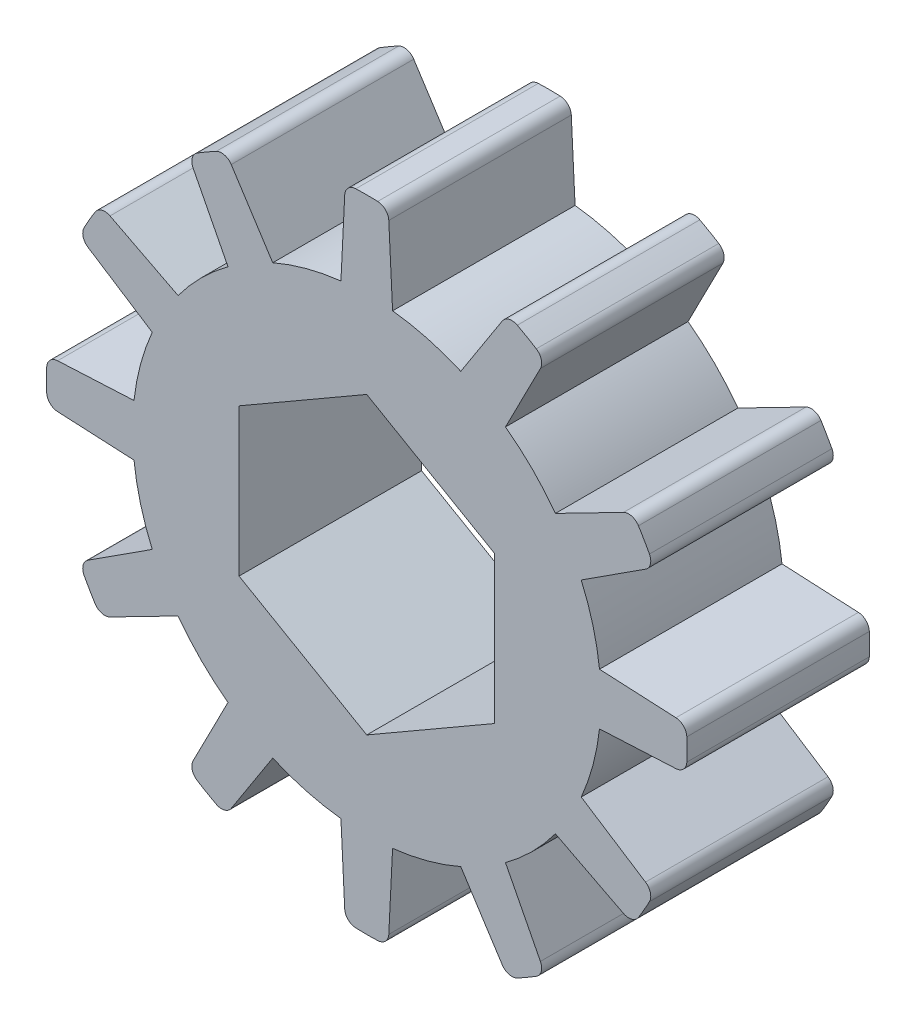
from build123d import *

# Parameters (mm, degrees)
CROQUIS1_R              = 0.5
SALIENTE_EXTRUIR1_DEPTH = 3.18
CORTAR_EXTRUIR3_DEPTH   = 9.508591314
REDONDEO1_R             = 0.2


with BuildPart() as part:
    # Croquis1 → Saliente-Extruir1 (new body)
    with BuildSketch(Plane.XY):
        with BuildLine():
            Line((0.375, 5.567875544), (0.45, 4.055600396))
            ThreePointArc((0.45, 4.055600396), (1.056108396, 3.941450193), (1.638088766, 3.737252971))
            Line((1.638088766, 3.737252971), (2.459178246, 5.009421667))
            ThreePointArc((2.459178246, 5.009421667), (2.790244751, 4.832845674), (3.108697299, 4.634421667))
            Line((3.108697299, 4.634421667), (2.41751163, 3.287252971))
            ThreePointArc((2.41751163, 3.287252971), (2.885341797, 2.885341797), (3.287252971, 2.41751163))
            Line((3.287252971, 2.41751163), (4.634421667, 3.108697299))
            ThreePointArc((4.634421667, 3.108697299), (4.832845674, 2.790244751), (5.009421667, 2.459178246))
            Line((5.009421667, 2.459178246), (3.737252971, 1.638088766))
            ThreePointArc((3.737252971, 1.638088766), (3.941450193, 1.056108396), (4.055600396, 0.45))
            Line((4.055600396, 0.45), (5.567875544, 0.375))
            ThreePointArc((5.567875544, 0.375), (5.580489502, 0), (5.567875544, -0.375))
            Line((5.567875544, -0.375), (4.055600396, -0.45))
            ThreePointArc((4.055600396, -0.45), (3.941450193, -1.056108396), (3.737252971, -1.638088766))
            Line((3.737252971, -1.638088766), (5.009421667, -2.459178246))
            ThreePointArc((5.009421667, -2.459178246), (4.832845674, -2.790244751), (4.634421667, -3.108697299))
            Line((4.634421667, -3.108697299), (3.287252971, -2.41751163))
            ThreePointArc((3.287252971, -2.41751163), (2.885341797, -2.885341797), (2.41751163, -3.287252971))
            Line((2.41751163, -3.287252971), (3.108697299, -4.634421667))
            ThreePointArc((3.108697299, -4.634421667), (2.790244751, -4.832845674), (2.459178246, -5.009421667))
            Line((2.459178246, -5.009421667), (1.638088766, -3.737252971))
            ThreePointArc((1.638088766, -3.737252971), (1.056108396, -3.941450193), (0.45, -4.055600396))
            Line((0.45, -4.055600396), (0.375, -5.567875544))
            ThreePointArc((0.375, -5.567875544), (0, -5.580489502), (-0.375, -5.567875544))
            Line((-0.375, -5.567875544), (-0.45, -4.055600396))
            ThreePointArc((-0.45, -4.055600396), (-1.056108396, -3.941450193), (-1.638088766, -3.737252971))
            Line((-1.638088766, -3.737252971), (-2.459178246, -5.009421667))
            ThreePointArc((-2.459178246, -5.009421667), (-2.790244751, -4.832845674), (-3.108697299, -4.634421667))
            Line((-3.108697299, -4.634421667), (-2.41751163, -3.287252971))
            ThreePointArc((-2.41751163, -3.287252971), (-2.885341797, -2.885341797), (-3.287252971, -2.41751163))
            Line((-3.287252971, -2.41751163), (-4.634421667, -3.108697299))
            ThreePointArc((-4.634421667, -3.108697299), (-4.832845674, -2.790244751), (-5.009421667, -2.459178246))
            Line((-5.009421667, -2.459178246), (-3.737252971, -1.638088766))
            ThreePointArc((-3.737252971, -1.638088766), (-3.941450193, -1.056108396), (-4.055600396, -0.45))
            Line((-4.055600396, -0.45), (-5.567875544, -0.375))
            ThreePointArc((-5.567875544, -0.375), (-5.580489502, 0), (-5.567875544, 0.375))
            Line((-5.567875544, 0.375), (-4.055600396, 0.45))
            ThreePointArc((-4.055600396, 0.45), (-3.941450193, 1.056108396), (-3.737252971, 1.638088766))
            Line((-3.737252971, 1.638088766), (-5.009421667, 2.459178246))
            ThreePointArc((-5.009421667, 2.459178246), (-4.832845674, 2.790244751), (-4.634421667, 3.108697299))
            Line((-4.634421667, 3.108697299), (-3.287252971, 2.41751163))
            ThreePointArc((-3.287252971, 2.41751163), (-2.885341797, 2.885341797), (-2.41751163, 3.287252971))
            Line((-2.41751163, 3.287252971), (-3.108697299, 4.634421667))
            ThreePointArc((-3.108697299, 4.634421667), (-2.790244751, 4.832845674), (-2.459178246, 5.009421667))
            Line((-2.459178246, 5.009421667), (-1.638088766, 3.737252971))
            ThreePointArc((-1.638088766, 3.737252971), (-1.056108396, 3.941450193), (-0.45, 4.055600396))
            Line((-0.45, 4.055600396), (-0.375, 5.567875544))
            ThreePointArc((-0.375, 5.567875544), (0, 5.580489502), (0.375, 5.567875544))
        make_face()
        Circle(CROQUIS1_R, mode=Mode.SUBTRACT)
    extrude(amount=SALIENTE_EXTRUIR1_DEPTH)

    # Croquis10 → Cortar-Extruir3 (cut, through all)
    with BuildSketch(Plane(origin=(0, 0, 0), x_dir=(-1, 0, 0), z_dir=(0, 0, -1))):
        Polygon((0, -2.569208698), (2.225, -1.284604349), (2.225, 1.284604349), (0, 2.569208698), (-2.225, 1.284604349), (-2.225, -1.284604349), align=None)
    extrude(amount=-CORTAR_EXTRUIR3_DEPTH, mode=Mode.SUBTRACT)

    # Redondeo1
    redondeo1_edges = [part.edges().sort_by_distance(p)[0] for p in [
        (5.567875544, -0.375, 1.59),
        (-2.459178246, -5.009421667, 1.59),
        (-3.108697299, -4.634421667, 1.59),
        (0.375, -5.567875544, 1.59),
        (-0.375, -5.567875544, 1.59),
        (3.108697299, -4.634421667, 1.59),
        (2.459178246, -5.009421667, 1.59),
        (5.009421667, -2.459178246, 1.59),
        (4.634421667, -3.108697299, 1.59),
        (-4.634421667, -3.108697299, 1.59),
        (-5.009421667, -2.459178246, 1.59),
        (-5.567875544, -0.375, 1.59),
        (-5.567875544, 0.375, 1.59),
        (-5.009421667, 2.459178246, 1.59),
        (-4.634421667, 3.108697299, 1.59),
        (-3.108697299, 4.634421667, 1.59),
        (-2.459178246, 5.009421667, 1.59),
        (5.567875544, 0.375, 1.59),
        (5.009421667, 2.459178246, 1.59),
        (4.634421667, 3.108697299, 1.59),
        (3.108697299, 4.634421667, 1.59),
        (2.459178246, 5.009421667, 1.59),
        (0.375, 5.567875544, 1.59),
        (-0.375, 5.567875544, 1.59),
    ]]
    fillet(redondeo1_edges, radius=REDONDEO1_R)


solid = part.part
